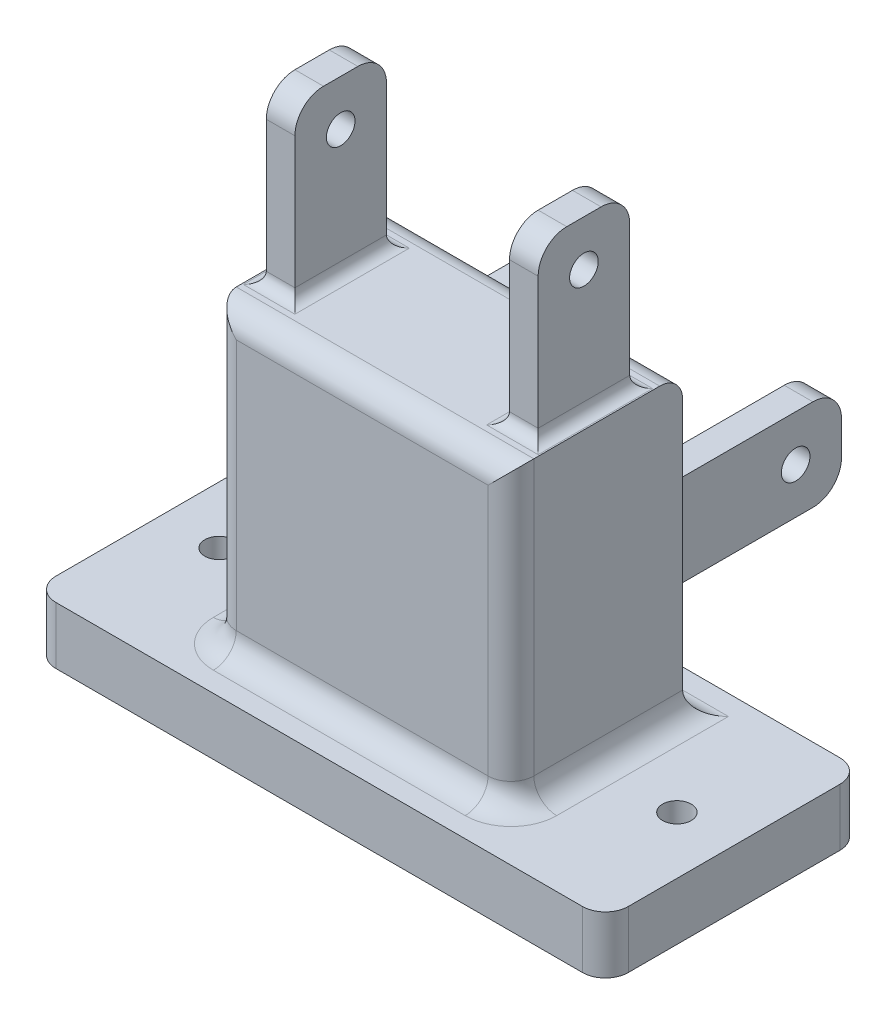
from build123d import *

# Parameters (mm, degrees)
SKETCH1_W           = 63.5
SKETCH1_H           = 28.575
BOSS_EXTRUDE1_DEPTH = 6.35
FILLET1_R           = 2.54
SKETCH2_W           = 33.02
SKETCH2_H           = 19.05
BOSS_EXTRUDE3_DEPTH = 33.02
SHELL1_START        = 6.35
SHELL1_OUTLINE_W    = 20.32
SHELL1_OUTLINE_H    = 6.35
SHELL1_DEPTH        = 26.67
SKETCH3_R           = 1.5875
CUT_EXTRUDE1_DEPTH  = 6.35
SKETCH4_W           = 3.175
SKETCH4_H           = 10.16
BOSS_EXTRUDE4_DEPTH = 19.05
FILLET4_R           = 1.27
FILLET6_R           = 3.175
SKETCH5_R           = 1.5875
CUT_EXTRUDE2_DEPTH  = 50.8
SKETCH8_W           = 3.175
SKETCH8_H           = 10.16
BOSS_EXTRUDE5_DEPTH = 19.05
SKETCH9_R           = 1.5875
CUT_EXTRUDE3_DEPTH  = 50.8
FILLET7_R           = 1.27
FILLET8_R           = 2.54
FILLET9_R           = 3.175


# Read off the part's stored shape, not the designer's step: Shell1
with BuildPart() as part:
    # Sketch1 → Boss-Extrude1 (new body)
    with BuildSketch(Plane(origin=(0, 0, 0), x_dir=(1, 0, 0), z_dir=(0, 1, 0))):
        Rectangle(SKETCH1_W, SKETCH1_H)
    extrude(amount=BOSS_EXTRUDE1_DEPTH)

    # Fillet1
    fillet1_edges = [part.edges().sort_by_distance(p)[0] for p in [
        (31.75, 3.175, 14.2875),
        (-31.75, 3.175, 14.2875),
        (-31.75, 3.175, -14.2875),
        (31.75, 3.175, -14.2875),
    ]]
    fillet(fillet1_edges, radius=FILLET1_R)

    # Sketch2 → Boss-Extrude3 (add)
    with BuildSketch(Plane(origin=(0, 6.35, 0), x_dir=(1, 0, 0), z_dir=(0, 1, 0))):
        Rectangle(SKETCH2_W, SKETCH2_H)
    extrude(amount=BOSS_EXTRUDE3_DEPTH)

    # Shell1 outline → Shell1 (cut)
    with BuildSketch(Plane(origin=(0, 0, 0), x_dir=(1, 0, 0), z_dir=(0, 1, 0)).offset(SHELL1_START)):
        Rectangle(SHELL1_OUTLINE_W, SHELL1_OUTLINE_H)
    extrude(amount=SHELL1_DEPTH, mode=Mode.SUBTRACT)

    # Sketch3 → Cut-Extrude1 (cut)
    with BuildSketch(Plane.XZ):
        with Locations(Location((-25.4, 0, 0), (0, 0, 270))):
            Circle(SKETCH3_R)
        with Locations(Location((25.4, 0, 0), (0, 0, 270))):
            Circle(SKETCH3_R)
    extrude(amount=-CUT_EXTRUDE1_DEPTH, mode=Mode.SUBTRACT)

    # Sketch4 → Boss-Extrude4 (add)
    with BuildSketch(Plane(origin=(0, 39.37, 0), x_dir=(1, 0, 0), z_dir=(0, 1, 0))):
        with Locations((-13.49375, 0)):
            Rectangle(SKETCH4_W, SKETCH4_H)
        with Locations((13.49375, 0)):
            Rectangle(SKETCH4_W, SKETCH4_H)
    extrude(amount=BOSS_EXTRUDE4_DEPTH)

    # Fillet4
    fillet4_edges = [part.edges().sort_by_distance(p)[0] for p in [
        (15.08125, 39.37, 0),
        (13.49375, 39.37, -5.08),
        (11.90625, 39.37, 0),
        (13.49375, 39.37, 5.08),
        (-15.08125, 39.37, 0),
        (-13.49375, 39.37, 5.08),
        (-11.90625, 39.37, 0),
        (-13.49375, 39.37, -5.08),
    ]]
    fillet(fillet4_edges, radius=FILLET4_R)

    # Fillet6
    fillet6_edges = [part.edges().sort_by_distance(p)[0] for p in [
        (13.49375, 58.42, -5.08),
        (13.49375, 58.42, 5.08),
        (-13.49375, 58.42, 5.08),
        (-13.49375, 58.42, -5.08),
    ]]
    fillet(fillet6_edges, radius=FILLET6_R)

    # Sketch5 → Cut-Extrude2 (cut)
    with BuildSketch(Plane(origin=(15.08125, 0, 0), x_dir=(0, 0, -1), z_dir=(1, 0, 0))):
        with Locations((0, 53.34)):
            Circle(SKETCH5_R)
    extrude(amount=-CUT_EXTRUDE2_DEPTH, mode=Mode.SUBTRACT)

    # Sketch8 → Boss-Extrude5 (add)
    with BuildSketch(Plane(origin=(0, 0, -9.525), x_dir=(-1, 0, 0), z_dir=(0, 0, -1))):
        with Locations((-13.49375, 22.86)):
            Rectangle(SKETCH8_W, SKETCH8_H)
        with Locations((13.49375, 22.86)):
            Rectangle(SKETCH8_W, SKETCH8_H)
    extrude(amount=BOSS_EXTRUDE5_DEPTH)

    # Sketch9 → Cut-Extrude3 (cut)
    with BuildSketch(Plane(origin=(15.08125, 0, 0), x_dir=(0, 0, -1), z_dir=(1, 0, 0))):
        with Locations(Location((23.495, 22.86, 0), (0, 0, 90))):
            Circle(SKETCH9_R)
    extrude(amount=-CUT_EXTRUDE3_DEPTH, mode=Mode.SUBTRACT)

    # Fillet7
    fillet7_edges = [part.edges().sort_by_distance(p)[0] for p in [
        (-15.08125, 22.86, -9.525),
        (-13.49375, 27.94, -9.525),
        (-11.90625, 22.86, -9.525),
        (-13.49375, 17.78, -9.525),
        (13.49375, 17.78, -9.525),
        (11.90625, 22.86, -9.525),
        (13.49375, 27.94, -9.525),
        (15.08125, 22.86, -9.525),
    ]]
    fillet(fillet7_edges, radius=FILLET7_R)

    # Fillet8
    fillet8_edges = [part.edges().sort_by_distance(p)[0] for p in [
        (16.51, 6.35, 0),
        (16.51, 22.86, 9.525),
        (0, 6.35, -9.525),
        (-16.51, 6.35, 0),
        (0, 6.35, 9.525),
        (-16.51, 22.86, 9.525),
        (0, 39.37, -9.525),
        (0, 39.37, 9.525),
    ]]
    fillet(fillet8_edges, radius=FILLET8_R)

    # Fillet9
    fillet9_edges = [part.edges().sort_by_distance(p)[0] for p in [
        (-13.49375, 27.94, -28.575),
        (-13.49375, 17.78, -28.575),
        (13.49375, 17.78, -28.575),
        (13.49375, 27.94, -28.575),
    ]]
    fillet(fillet9_edges, radius=FILLET9_R)


solid = part.part
